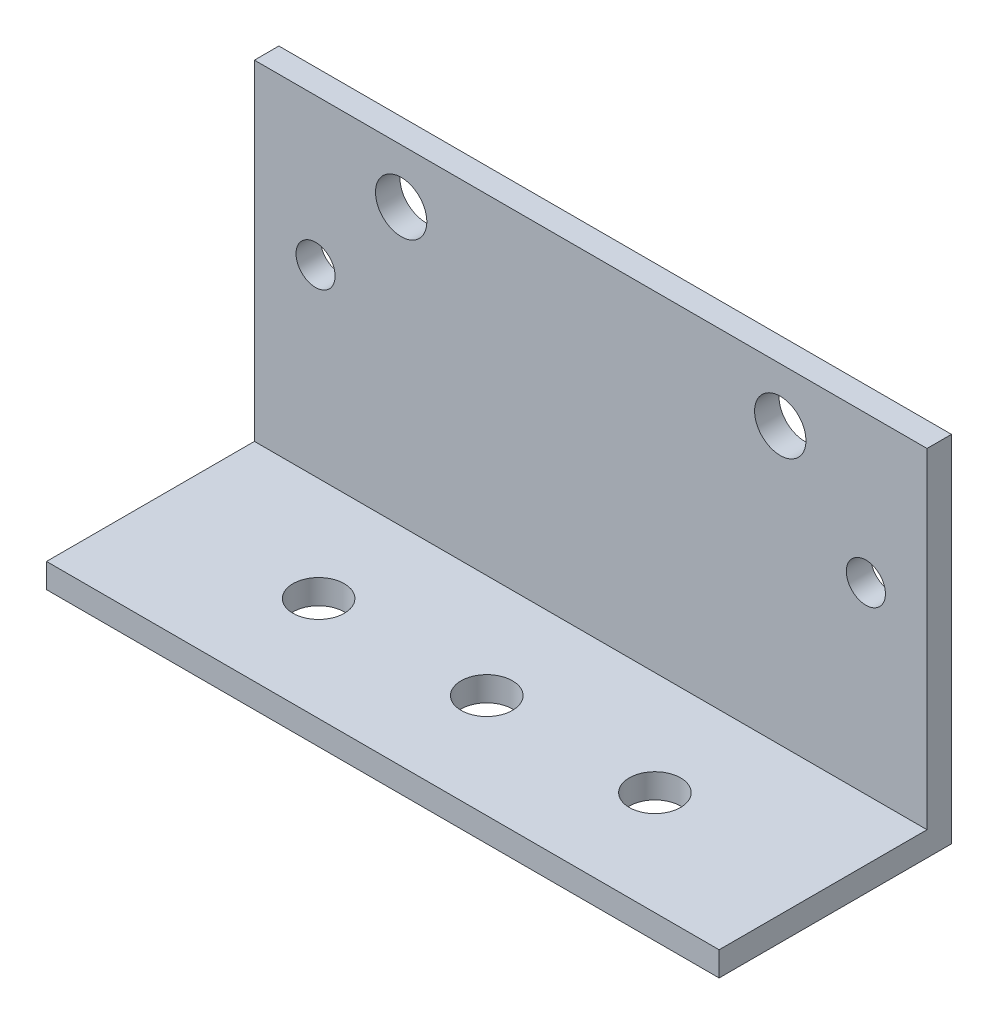
from build123d import *

# Parameters (mm, degrees)
ESQUISSE1_W             = 275
ESQUISSE1_H             = 145
ESQUISSE1_R             = 10.5
ESQUISSE1_R_2           = 8
BOSS_EXTRU_1_DEPTH      = 10
ESQUISSE2_W             = 275
ESQUISSE2_H             = 95
BOSS_EXTRU_2_DEPTH      = 10
ESQUISSE4_R             = 10.5
ENL_V_MAT_EXTRU_1_DEPTH = 321.741328799


with BuildPart() as part:
    # Esquisse1 → Boss.-Extru.1 (new body)
    with BuildSketch(Plane.XY):
        with Locations((137.5, 72.5)):
            Rectangle(ESQUISSE1_W, ESQUISSE1_H)
        with Locations((60, 123)):
            Circle(ESQUISSE1_R, mode=Mode.SUBTRACT)
        with Locations((25, 85)):
            Circle(ESQUISSE1_R_2, mode=Mode.SUBTRACT)
        with Locations((250, 85)):
            Circle(ESQUISSE1_R_2, mode=Mode.SUBTRACT)
        with Locations((215, 123)):
            Circle(ESQUISSE1_R, mode=Mode.SUBTRACT)
    extrude(amount=BOSS_EXTRU_1_DEPTH)

    # Esquisse2 → Boss.-Extru.2 (add)
    with BuildSketch(Plane(origin=(0, 0, 0), x_dir=(1, 0, 0), z_dir=(0, 1, 0))):
        with Locations((137.5, -47.5)):
            Rectangle(ESQUISSE2_W, ESQUISSE2_H)
    extrude(amount=BOSS_EXTRU_2_DEPTH)

    # Esquisse4 → Enlèv. mat.-Extru.1 (cut, through all)
    with BuildSketch(Plane(origin=(0, 10, 0), x_dir=(1, 0, 0), z_dir=(0, 1, 0))):
        with Locations((206.25, -52.5)):
            Circle(ESQUISSE4_R)
        with Locations((137.5, -52.5)):
            Circle(ESQUISSE4_R)
        with Locations((68.75, -52.5)):
            Circle(ESQUISSE4_R)
    extrude(amount=-ENL_V_MAT_EXTRU_1_DEPTH, mode=Mode.SUBTRACT)


solid = part.part
